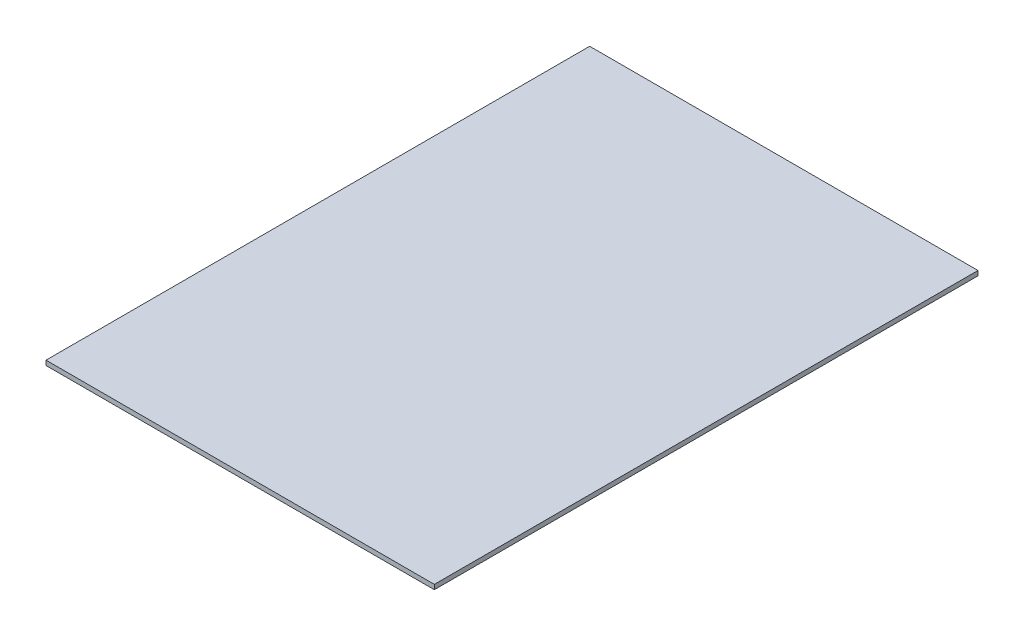
from build123d import *

# Parameters (mm, degrees)
SKETCH2_W           = 250
SKETCH2_H           = 350
BOSS_EXTRUDE1_DEPTH = 3


with BuildPart() as part:
    # Sketch2 → Boss-Extrude1 (new body)
    with BuildSketch(Plane(origin=(0, 0, 0), x_dir=(1, 0, 0), z_dir=(0, 1, 0))):
        with Locations((125, 175)):
            Rectangle(SKETCH2_W, SKETCH2_H)
    extrude(amount=BOSS_EXTRUDE1_DEPTH)


solid = part.part
